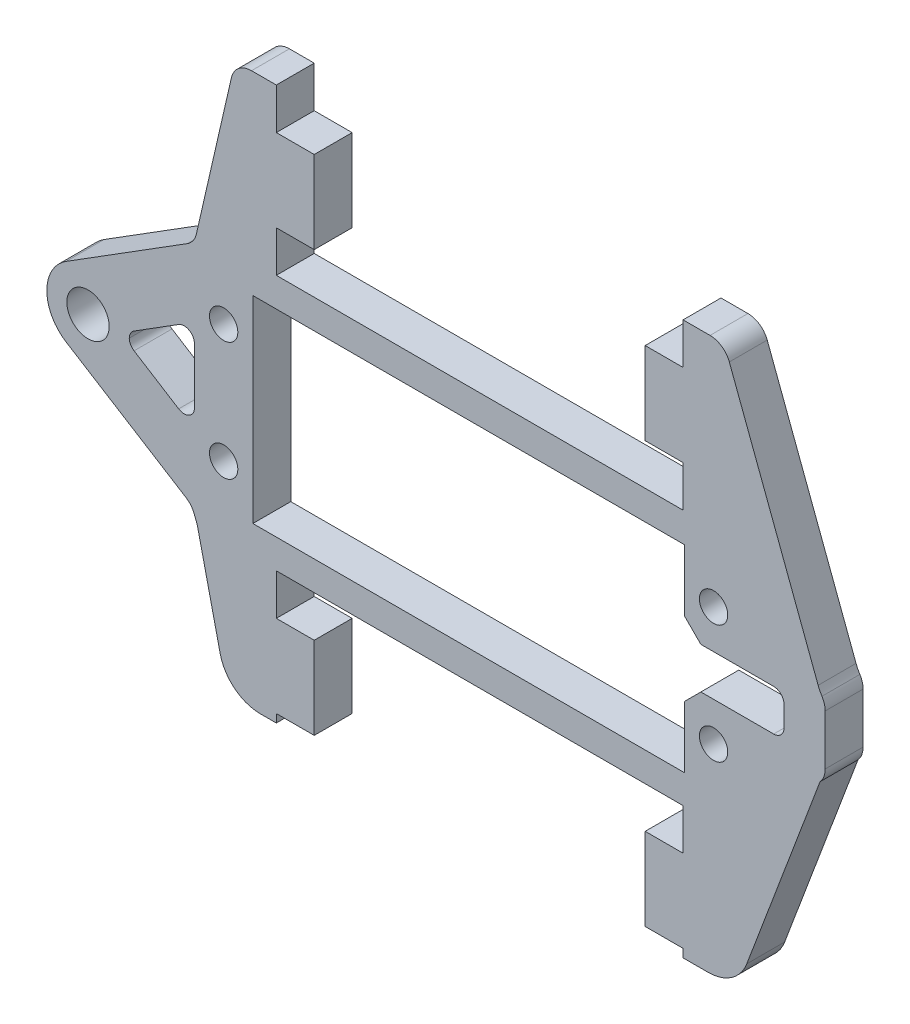
from build123d import *

# Parameters (mm, degrees)
SKETCH1_W                        = 66.494000054
SKETCH1_H                        = 30.426
BOSS_EXTRUDE1_DEPTH              = 5.842
F_11_64_0_17188_DIAMETER_HOLE1_D = 4.365752
F_0_257_DIAMETER_HOLE1_D         = 6.5278
BOSS_EXTRUDE3_DEPTH              = 5.842
F_0_257_DIAMETER_HOLE3_D         = 6.5278
SKETCH13_W                       = 8.999982
SKETCH13_H                       = 6.35
CUT_EXTRUDE1_DEPTH               = 105.431017222
CHAMFER1_SIZE                    = 2.54
BOSS_EXTRUDE6_DEPTH              = 5.842
FILLET1_R                        = 3.175
FILLET2_R                        = 1.5875
FILLET3_R                        = 1.5875
BOSS_EXTRUDE7_DEPTH              = 5.842
FILLET4_R                        = 3.175
FILLET5_R                        = 6.35
FILLET6_R                        = 3.175
CUT_EXTRUDE3_DEPTH               = 116.434993398
CUT_EXTRUDE4_DEPTH               = 116.434993398
FILLET10_R                       = 3.175
SKETCH29_W                       = 87.204685613
SKETCH29_H                       = 5.08
CUT_EXTRUDE6_DEPTH               = 116.434993398
FILLET12_R                       = 6.35


with BuildPart() as part:
    # Sketch1 → Boss-Extrude1 (new body)
    with BuildSketch(Plane.XY):
        with BuildLine():
            Line((-75.493982054, 0), (-75.493982054, 30.426))
            ThreePointArc((-75.493982054, 30.426), (-74.175965205, 33.607974151), (-70.993991054, 34.925991))
            Line((-70.993991054, 34.925991), (4.499991, 34.925991))
            ThreePointArc((4.499991, 34.925991), (7.681965151, 33.607974151), (8.999982, 30.426))
            Line((8.999982, 30.426), (8.999982, 0))
            Line((8.999982, 0), (11.100760908, -11.565106481))
            ThreePointArc((11.100760908, -11.565106481), (7.160083484, -18.61606843), (-0.513638035, -16.094362457))
            Line((-0.513638035, -16.094362457), (-7.847000027, -4.499991))
            Line((-7.847000027, -4.499991), (-58.647000027, -4.499991))
            Line((-58.647000027, -4.499991), (-65.980362019, -16.094362457))
            ThreePointArc((-65.980362019, -16.094362457), (-73.654083538, -18.61606843), (-77.594760962, -11.565106481))
            Line((-77.594760962, -11.565106481), (-75.493982054, 0))
        make_face()
        with Locations((-33.247000027, 15.213)):
            Rectangle(SKETCH1_W, SKETCH1_H, mode=Mode.SUBTRACT)
    extrude(amount=BOSS_EXTRUDE1_DEPTH)

    # 11/64 (0.17188) Diameter Hole1 (through all)
    with Locations(Plane.XY.offset(5.842)):
        with Locations((-70.993991054, 24.357), (-70.993991054, 6.069)):
            f_11_64_0_17188_diameter_hole1 = Hole(F_11_64_0_17188_DIAMETER_HOLE1_D / 2)

    # Mirror1: 11/64 (0.17188) Diameter Hole1 across plane
    add(f_11_64_0_17188_diameter_hole1.mirror(Plane.ZY.offset(33.247000027)), mode=Mode.SUBTRACT)

    # F (0.257) Diameter Hole1 (through all)
    with Locations(Plane.XY.offset(5.842)):
        with Locations((-71.347000027, -12.7)):
            f_0_257_diameter_hole1 = Hole(F_0_257_DIAMETER_HOLE1_D / 2)

    # Mirror2: F (0.257) Diameter Hole1 across plane
    add(f_0_257_diameter_hole1.mirror(Plane.ZY.offset(33.247000027)), mode=Mode.SUBTRACT)

    # Sketch10 → Boss-Extrude3 (add)
    with BuildSketch(Plane.XY.offset(5.842)):
        with BuildLine():
            Line((-95.26734363, 20.592874824), (-73.384544712, 34.314048933))
            Line((-73.384544712, 34.314048933), (-68.603437396, 34.314048933))
            Line((-68.603437396, 34.314048933), (-75.493982054, 30.426))
            Line((-75.493982054, 30.426), (-75.493982054, 22.368465679))
            Line((-75.493982054, 22.368465679), (-85.597223399, 16.03342901))
            ThreePointArc((-85.597223399, 16.03342901), (-85.544000054, 15.213), (-85.597223399, 14.39257099))
            Line((-85.597223399, 14.39257099), (-75.493982054, 8.057534321))
            Line((-75.493982054, 8.057534321), (-75.493982054, 0))
            Line((-75.493982054, 0), (-75.901345831, -2.242599371))
            Line((-75.901345831, -2.242599371), (-95.26734363, 9.833125176))
            ThreePointArc((-95.26734363, 9.833125176), (-98.244000054, 15.213), (-95.26734363, 20.592874824))
        make_face()
    extrude(amount=-BOSS_EXTRUDE3_DEPTH)

    # F (0.257) Diameter Hole3 (through all)
    with Locations(Plane.XY.offset(5.842)):
        with Locations((-91.894000054, 15.213)):
            Hole(F_0_257_DIAMETER_HOLE3_D / 2)

    # Sketch13 → Cut-Extrude1 (cut, through all)
    with BuildSketch(Plane.XY.offset(5.842)):
        with Locations((4.499991, 15.213)):
            Rectangle(SKETCH13_W, SKETCH13_H)
    extrude(amount=-CUT_EXTRUDE1_DEPTH, mode=Mode.SUBTRACT)

    # Chamfer1
    chamfer1_edges = [part.edges().sort_by_distance(p)[0] for p in [
        (0, 12.038, 2.921),
        (0, 18.388, 2.921),
    ]]
    chamfer(chamfer1_edges, length=CHAMFER1_SIZE)

    # Sketch22 → Boss-Extrude6 (add)
    with BuildSketch(Plane.XY.offset(5.842)):
        Polygon((8.999982, 18.388), (8.999982, 24.738), (21.699982, 21.563), (21.699982, 8.863), (8.999982, 5.688), (8.999982, 12.038), (15.349982, 12.038), (15.349982, 18.388), align=None)
    extrude(amount=-BOSS_EXTRUDE6_DEPTH)

    # Fillet1
    fillet1_edges = [part.edges().sort_by_distance(p)[0] for p in [
        (8.999982, 24.738, 2.921),
        (21.699982, 21.563, 2.921),
        (21.699982, 8.863, 2.921),
        (8.999982, 5.688, 2.921),
    ]]
    fillet(fillet1_edges, radius=FILLET1_R)

    # Fillet2
    fillet2_edges = [part.edges().sort_by_distance(p)[0] for p in [
        (15.349982, 18.388, 2.921),
        (15.349982, 12.038, 2.921),
    ]]
    fillet(fillet2_edges, radius=FILLET2_R)

    # Fillet3
    # the kernel refuses this fillet: 1.5875 mm, written as the material it adds along each edge
    with BuildSketch(Plane(origin=(-75.493982054, 8.057534321, 5.842), x_dir=(0, 1, 0), z_dir=(0, 0, -1))) as fillet3_piece_1:
        with BuildLine():
            CenterArc((FILLET3_R * 1.80735498388, -FILLET3_R), FILLET3_R, 90, 122.088950954)
            Line((FILLET3_R * 0.960130602163, -FILLET3_R * 1.53123520876), (0, 0))
            Line((0, 0), (FILLET3_R * 1.80735498388, 0))
        make_face()
    extrude(amount=5.842)
    with BuildSketch(Plane(origin=(-75.493982054, 22.368465679, 5.842), x_dir=(0, -1, 0), z_dir=(0, 0, -1))) as fillet3_piece_2:
        with BuildLine():
            CenterArc((FILLET3_R * 1.80735498388, FILLET3_R), FILLET3_R, 147.911049046, 122.088950954)
            Line((FILLET3_R * 0.960130602163, FILLET3_R * 1.53123520876), (0, 0))
            Line((0, 0), (FILLET3_R * 1.80735498388, 0))
        make_face()
    extrude(amount=5.842)
    with BuildSketch(Plane(origin=(-85.597223399, 14.39257099, 5.842), x_dir=(0.06319147380474219, 0.9980014216615047, 0), z_dir=(0, 0, -1))) as fillet3_piece_3:
        with BuildLine():
            CenterArc((0.946995123, 1.584009043), FILLET3_R, 208.465932253, 57.73363863)
            Line((-0.448577196, 0.827349177), (0, 0))
            ThreePointArc((0, 0), (0.420886721, 0.013963828), (0.841773443, 0))
        make_face()
    extrude(amount=5.842)
    with BuildSketch(Plane(origin=(-85.597223399, 16.03342901, 5.842), x_dir=(0.8472243817163825, 0.5312352087590706, 0), z_dir=(0, 0, -1))) as fillet3_piece_4:
        with BuildLine():
            CenterArc((0.94113132, 1.5875), FILLET3_R, 212.26636137, 57.73363863)
            ThreePointArc((-0.401219641, 0.7400036), (-0.18833421, 0.376657465), (0, 0))
            Line((0, 0), (0.94113132, 0))
        make_face()
    extrude(amount=5.842)

    # Sketch24 → Boss-Extrude7 (add)
    with BuildSketch(Plane(origin=(0, 0, 0), x_dir=(-1, 0, 0), z_dir=(0, 0, -1))):
        Polygon((57.037580054, 48.794391), (57.037580054, 41.275991), (62.879580054, 41.275991), (62.879580054, 34.925991), (70.993991054, 34.925991), (73.259602339, 34.314048933), (73.384544712, 34.314048933), (75.493982054, 32.991368176), (69.229580054, 60.325991), (62.879580054, 60.325991), (62.879580054, 53.975991), (57.037580054, 53.975991), align=None)
        Polygon((0.200579946, 60.325991), (-6.149420054, 60.325991), (-21.699982, 19.08403491), (-9.699273994, 22.99974755), (0.200579946, 34.925991), (0.200579946, 41.275991), (6.042579946, 41.275991), (6.042579946, 48.794391), (6.042579946, 53.975991), (0.200579946, 53.975991), align=None)
    boss_extrude7 = extrude(amount=-BOSS_EXTRUDE7_DEPTH)

    # Fillet4
    fillet4_edges = [part.edges().sort_by_distance(p)[0] for p in [
        (-75.493982054, 32.991368176, 2.921),
        (-69.229580054, 60.325991, 2.921),
    ]]
    fillet(fillet4_edges, radius=FILLET4_R)

    # Fillet5
    fillet5_edges = [part.edges().sort_by_distance(p)[0] for p in [
        (20.909565621, 21.180313983, 2.921),
    ]]
    fillet(fillet5_edges, radius=FILLET5_R)

    # Fillet6
    fillet6_edges = [part.edges().sort_by_distance(p)[0] for p in [
        (6.149420054, 60.325991, 2.921),
    ]]
    fillet(fillet6_edges, radius=FILLET6_R)

    # Sketch26 → Cut-Extrude3 (cut, through all)
    with BuildSketch(Plane(origin=(0, 0, 0), x_dir=(-1, 0, 0), z_dir=(0, 0, -1))):
        Polygon((89.149059257, -30.603913947), (-16.445159676, -30.603913947), (-16.445159676, -4.499991), (-16.445159676, 1.604517455), (-8.999982, 1.604517455), (-8.999982, -4.499991), (75.901345831, -4.499991), (75.901345831, -2.242599371), (89.149059257, -2.242599371), (89.149059257, -4.499991), align=None)
    extrude(amount=-CUT_EXTRUDE3_DEPTH, mode=Mode.SUBTRACT)

    # Mirror3: Boss-Extrude7 across plane
    add(boss_extrude7.mirror(Plane(origin=(0, 15.213, 0), x_dir=(0, 0, 1), z_dir=(0, -1, 0))))

    # Sketch28 → Cut-Extrude4 (cut, through all)
    with BuildSketch(Plane(origin=(0, 0, 0), x_dir=(-1, 0, 0), z_dir=(0, 0, -1))):
        Polygon((75.050615589, -4.499991), (75.901345831, -2.242599371), (75.901345831, -4.499991), align=None)
    extrude(amount=-CUT_EXTRUDE4_DEPTH, mode=Mode.SUBTRACT)

    # Fillet10
    fillet10_edges = [part.edges().sort_by_distance(p)[0] for p in [
        (6.149420054, -29.899991, 2.921),
        (-75.050615589, -4.499991, 2.921),
        (-69.229580054, -29.899991, 2.921),
        (-75.901345831, -2.242599371, 2.921),
    ]]
    fillet(fillet10_edges, radius=FILLET10_R)

    # Sketch29 → Cut-Extrude6 (cut, through all)
    with BuildSketch(Plane.XY.offset(5.842)):
        with Locations((-32.135383003, -27.359991)):
            Rectangle(SKETCH29_W, SKETCH29_H)
    extrude(amount=-CUT_EXTRUDE6_DEPTH, mode=Mode.SUBTRACT)

    # Fillet12
    fillet12_edges = [part.edges().sort_by_distance(p)[0] for p in [
        (8.064868839, -24.819991, 2.921),
        (-70.393787161, -24.819991, 2.921),
    ]]
    fillet(fillet12_edges, radius=FILLET12_R)


solid = part.part
